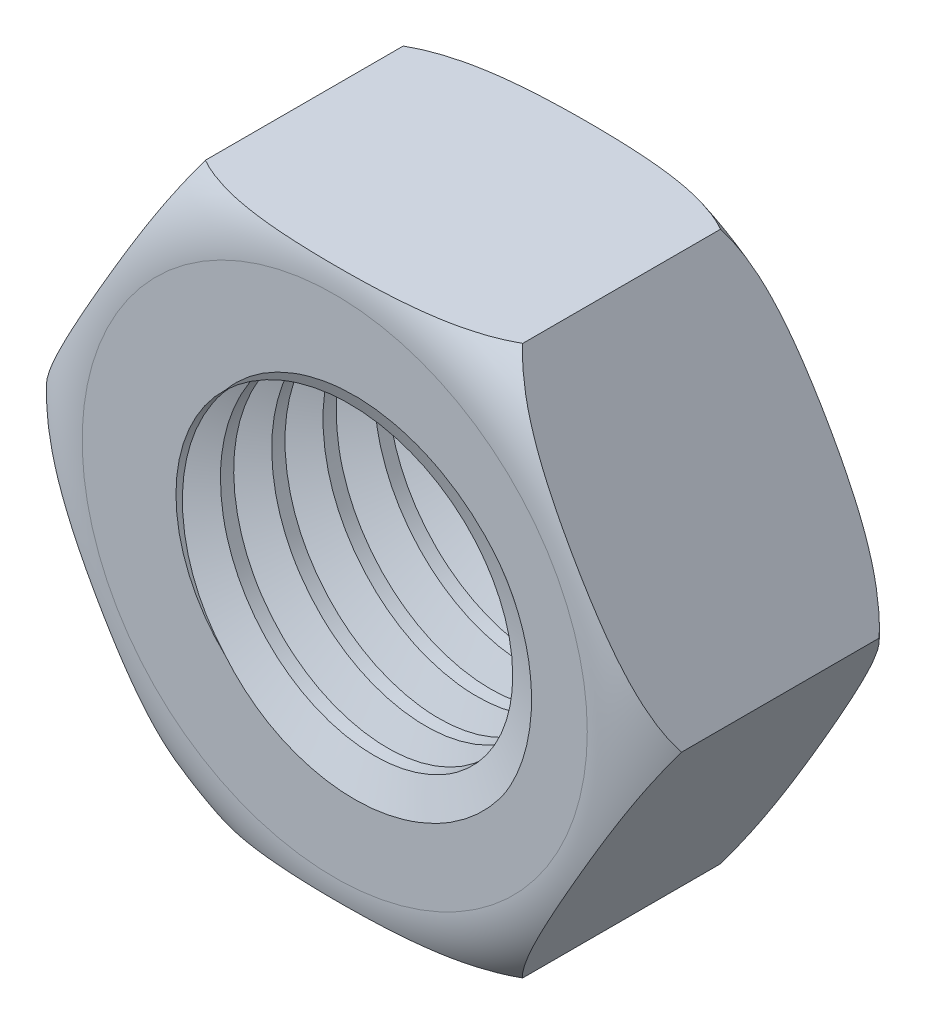
from build123d import *

# Parameters (mm, degrees)
BOSS_EXTRUDE1_DEPTH = 6.6675
SKETCH6_R           = 8.255
CUT_EXTRUDE2_DEPTH  = 6.6675
CUT_SWEEP1_PITCH    = 2.667


with BuildPart() as part:
    # Sketch1 → Boss-Extrude1 (new, symmetric)
    with BuildSketch(Plane.XY):
        Polygon((-16.497783942, 0), (-8.248891971, -14.2875), (8.248891971, -14.2875), (16.497783942, 0), (8.248891971, 14.2875), (-8.248891971, 14.2875), align=None)
    extrude(amount=BOSS_EXTRUDE1_DEPTH, both=True)

    # Sketch4 → Cut-Revolve1 (revolve, cut)
    with BuildSketch(Plane(origin=(0, 0, 0), x_dir=(1, 0, 0), z_dir=(0, 1, 0)), mode=Mode.PRIVATE) as cut_revolve1_sk:
        with BuildLine():
            Line((-13.1318, 6.6675), (-16.497783942, 6.6675))
            Line((-16.497783942, 6.6675), (-16.497783942, 5.1435))
            ThreePointArc((-16.497783942, 5.1435), (-14.97925933, 6.268750976), (-13.1318, 6.6675))
        make_face()
    cut_revolve1 = revolve(cut_revolve1_sk.sketch.rotate(Axis((0, 0, 6.6675), (0, 0, -1)), 180), axis=Axis((0, 0, 6.6675), (0, 0, -1)), mode=Mode.SUBTRACT)

    # Mirror2: Cut-Revolve1 across plane
    add(cut_revolve1.mirror(Plane.XY), mode=Mode.SUBTRACT)

    # Sketch6 → Cut-Extrude2 (cut, symmetric)
    with BuildSketch(Plane.XY):
        Circle(SKETCH6_R)
    extrude(amount=CUT_EXTRUDE2_DEPTH, both=True, mode=Mode.SUBTRACT)

    # Cut-Sweep1: the profile of Sketch10 profile screwed along a right-hand helix of 8 turns, 10 arcs to a turn; built about Z, then put on its axis
    cut_sweep1_z = Axis((0, 0, 0), (0, 0, 1))
    cut_sweep1_corners = [(8.2547, 0, -0.989100566), (8.2547, 0, 0.989100566), (10.076067606, 0, 0.234665401), (10.232866014, 0, 0), (10.076067606, 0, -0.234665401)]
    with BuildLine(mode=Mode.PRIVATE) as cut_sweep1_profile:
        Line(cut_sweep1_corners[0], cut_sweep1_corners[1])
        Line(cut_sweep1_corners[1], cut_sweep1_corners[2])
        Line(cut_sweep1_corners[4], cut_sweep1_corners[0])
        ThreePointArc((10.076067606, 0, 0.234665401), (10.190059295, 0, 0.141114839), (10.232866014, 0, 0))
        ThreePointArc((10.232866014, 0, 0), (10.190059295, 0, -0.141114839), (10.076067606, 0, -0.234665401))
    cut_sweep1_cap = Face(cut_sweep1_profile.wire())
    cut_sweep1_arcs = [((10.076067606, 0, 0.234665401), (10.232866014, 0, 0.169717374), (10.232866014, 0, 0), (1, 0.8314696123025441, 1)), ((10.232866014, 0, 0), (10.232866014, 0, -0.169717374), (10.076067606, 0, -0.234665401), (1, 0.8314696123025441, 1))]  # start, shoulder, end, weights
    cut_sweep1_turn_angles = [0, 18, 36, 54, 72, 90, 108, 126, 144, 162, 180, 198, 216, 234, 252, 270, 288, 306, 324, 342, 360]
    cut_sweep1_turn_weights = [1, 0.9510565162951535, 1, 0.9510565162951535, 1, 0.9510565162951535, 1, 0.9510565162951535, 1, 0.9510565162951535, 1, 0.9510565162951535, 1, 0.9510565162951535, 1, 0.9510565162951535, 1, 0.9510565162951535, 1, 0.9510565162951535, 1]
    cut_sweep1_turn_rails = [Edge.make_bspline([Vector(p[0], p[1], 0).rotate(cut_sweep1_z, cut_sweep1_turn_angles[k]) / cut_sweep1_turn_weights[k] + Vector(0, 0, p[2] + CUT_SWEEP1_PITCH * cut_sweep1_turn_angles[k] / 360) for k in range(21)], [0, 0, 0, 1, 1, 2, 2, 3, 3, 4, 4, 5, 5, 6, 6, 7, 7, 8, 8, 9, 9, 10, 10, 10], 2, cut_sweep1_turn_weights) for p in cut_sweep1_corners]
    cut_sweep1_turn_sides = [*[Face.make_surface_from_curves(cut_sweep1_turn_rails[p[0]], cut_sweep1_turn_rails[p[1]]) for p in [(0, 1), (1, 2), (4, 0)]], *[Face.make_bezier_surface([[Vector(p[j][0], p[j][1], 0).rotate(cut_sweep1_z, cut_sweep1_turn_angles[2 * i + k]) / cut_sweep1_turn_weights[2 * i + k] + Vector(0, 0, p[j][2] + CUT_SWEEP1_PITCH * cut_sweep1_turn_angles[2 * i + k] / 360) for k in range(3)] for j in range(3)], [[p[3][j] * cut_sweep1_turn_weights[2 * i + k] for k in range(3)] for j in range(3)]) for p in cut_sweep1_arcs for i in range(10)]]
    cut_sweep1 = Plane(origin=(0, 0, 9.3345), x_dir=(1, 0, 0), z_dir=(0, 0, -1)) * Solid(Shell([*[p.moved(Location((0, 0, CUT_SWEEP1_PITCH * i))) for i in range(8) for p in cut_sweep1_turn_sides], cut_sweep1_cap, cut_sweep1_cap.rotate(cut_sweep1_z, 2880).moved(Location((0, 0, CUT_SWEEP1_PITCH * 2880 / 360)))]))
    add(cut_sweep1, mode=Mode.SUBTRACT)


solid = part.part
